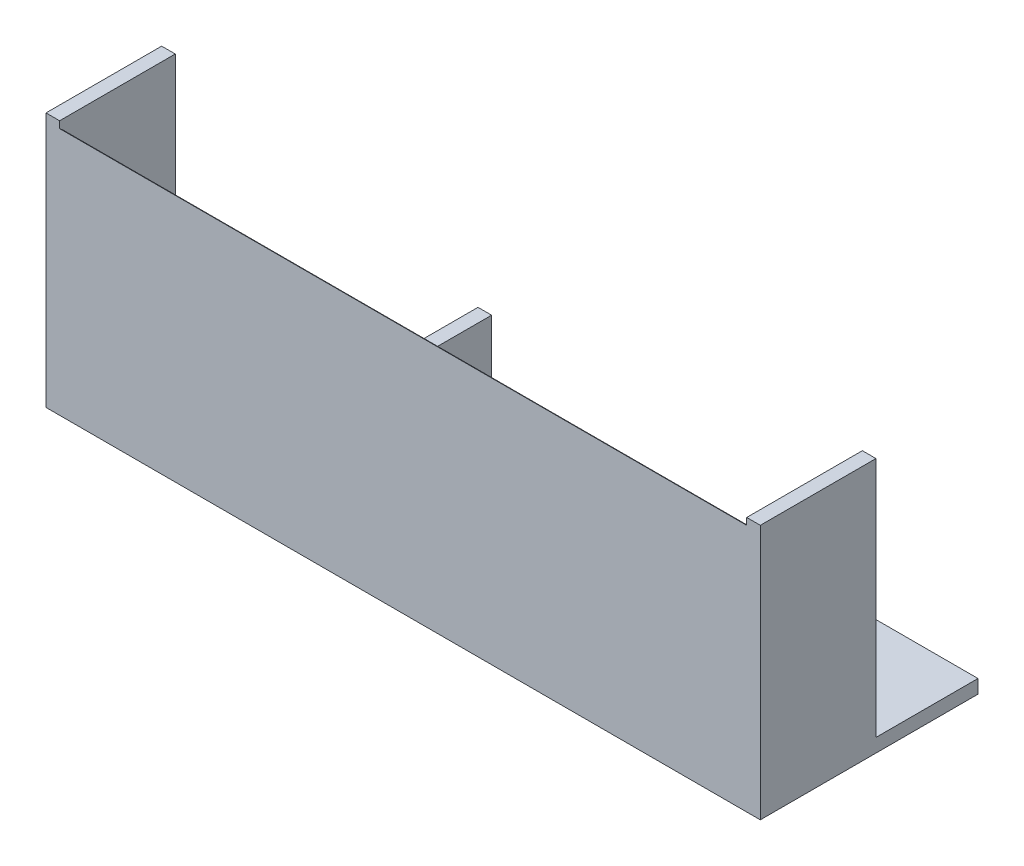
from build123d import *

# Parameters (mm, degrees)
SKETCH1_W           = 210
SKETCH1_H           = 75
BOSS_EXTRUDE1_DEPTH = 4
SKETCH2_W           = 210
SKETCH2_H           = 4
BOSS_EXTRUDE2_DEPTH = 60
SKETCH3_W           = 4
SKETCH3_H           = 71
BOSS_EXTRUDE3_DEPTH = 30
FILLET1_R           = 10
SKETCH5_W           = 4
SKETCH5_H           = 61
BOSS_EXTRUDE4_DEPTH = 20


with BuildPart() as part:
    # Sketch1 → Boss-Extrude1 (new body)
    with BuildSketch(Plane.XY):
        with Locations((-9.965753425, 81.934931507)):
            Rectangle(SKETCH1_W, SKETCH1_H)
    extrude(amount=BOSS_EXTRUDE1_DEPTH)

    # Sketch2 → Boss-Extrude2 (add)
    with BuildSketch(Plane.XY):
        with Locations((-9.965753425, 46.434931507)):
            Rectangle(SKETCH2_W, SKETCH2_H)
    extrude(amount=-BOSS_EXTRUDE2_DEPTH)

    # Sketch3 → Boss-Extrude3 (add)
    with BuildSketch(Plane.XY):
        with Locations((-112.965753425, 83.934931507)):
            Rectangle(SKETCH3_W, SKETCH3_H)
        with Locations((93.034246575, 83.934931507)):
            Rectangle(SKETCH3_W, SKETCH3_H)
    extrude(amount=-BOSS_EXTRUDE3_DEPTH)

    # Fillet1
    # the kernel refuses this fillet: 10 mm, written as the material it takes off along each edge
    with BuildSketch(Plane(origin=(-110.965753425, 119.434931507, 0), x_dir=(0, 0, 1), z_dir=(1, 0, 0))) as fillet1_piece_1:
        with BuildLine():
            CenterArc((FILLET1_R, FILLET1_R), FILLET1_R, 180, 90)
            Line((0, FILLET1_R), (0, 0))
            Line((0, 0), (FILLET1_R, 0))
        make_face()
    extrude(amount=202, mode=Mode.SUBTRACT)

    # Sketch5 → Boss-Extrude4 (add)
    with BuildSketch(Plane(origin=(0, 0, 0), x_dir=(-1, 0, 0), z_dir=(0, 0, -1))):
        with Locations((9.965753425, 78.934931507)):
            Rectangle(SKETCH5_W, SKETCH5_H)
    extrude(amount=BOSS_EXTRUDE4_DEPTH)


solid = part.part
